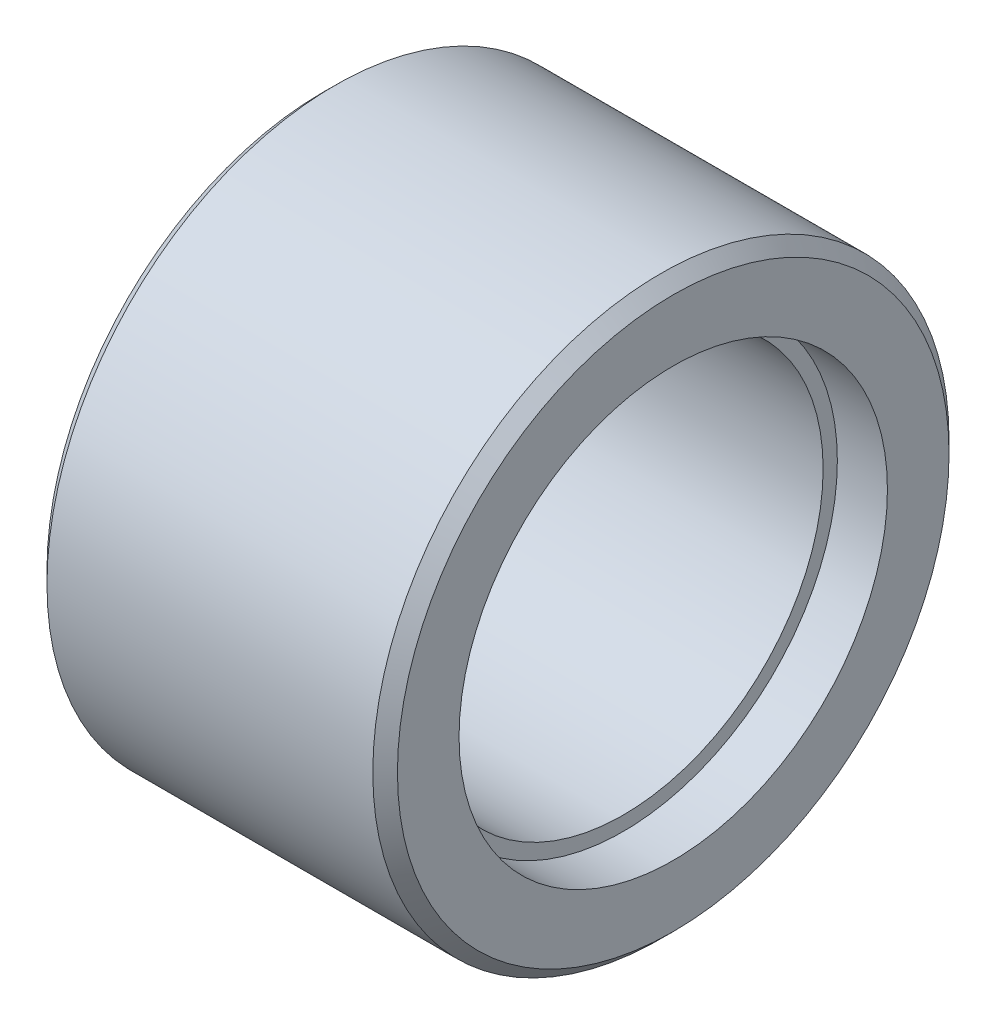
from build123d import *


with BuildPart() as part:
    # Sketch1 → Revolve1 (revolve)
    with BuildSketch(Plane.XY):
        Polygon((-75.899656867, 8.69315), (-73.867656867, 8.69315), (-73.867656867, 8.1153), (-63.707656867, 8.1153), (-63.707656867, 8.69315), (-61.675656867, 8.69315), (-61.675656867, 11.19315), (-62.175656867, 11.69315), (-75.399656867, 11.69315), (-75.899656867, 11.19315), align=None)
    revolve(axis=Axis((0, 0, 0), (-1, 0, 0)))


solid = part.part
